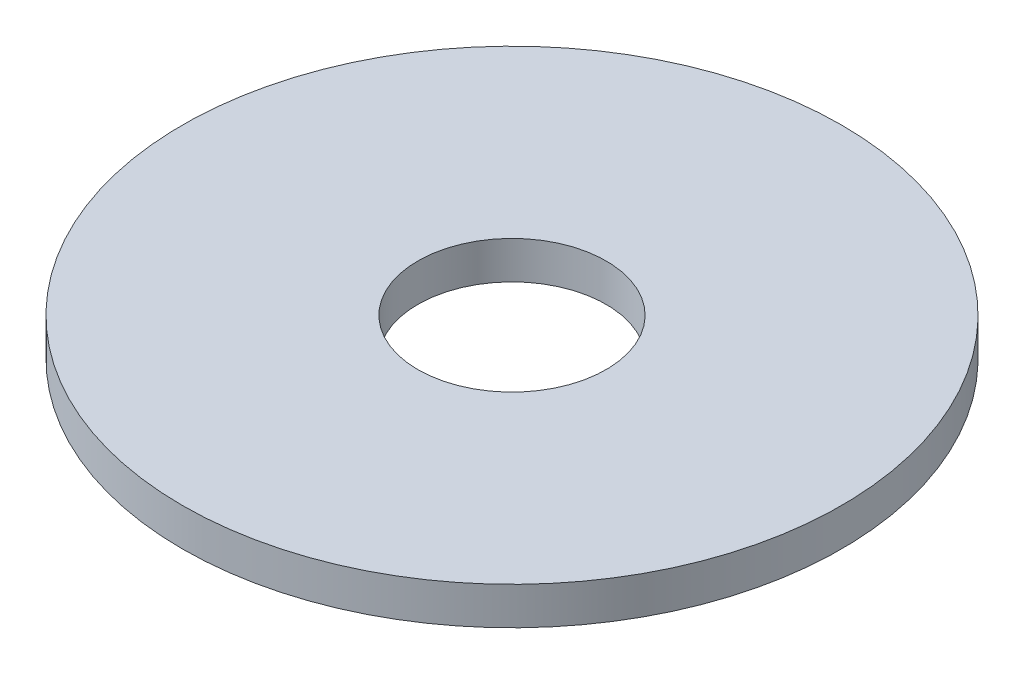
from build123d import *

# Parameters (mm, degrees)
SKETCH1_R           = 52.5
BOSS_EXTRUDE1_DEPTH = 6
SKETCH2_R           = 15
CUT_EXTRUDE1_DEPTH  = 75.488254108


with BuildPart() as part:
    # Sketch1 → Boss-Extrude1 (new body)
    with BuildSketch(Plane(origin=(0, 0, 0), x_dir=(1, 0, 0), z_dir=(0, 1, 0))):
        Circle(SKETCH1_R)
    extrude(amount=BOSS_EXTRUDE1_DEPTH)

    # Sketch2 → Cut-Extrude1 (cut, through all)
    with BuildSketch(Plane(origin=(0, 0, 0), x_dir=(1, 0, 0), z_dir=(0, 1, 0))):
        Circle(SKETCH2_R)
    extrude(amount=CUT_EXTRUDE1_DEPTH, mode=Mode.SUBTRACT)


solid = part.part
